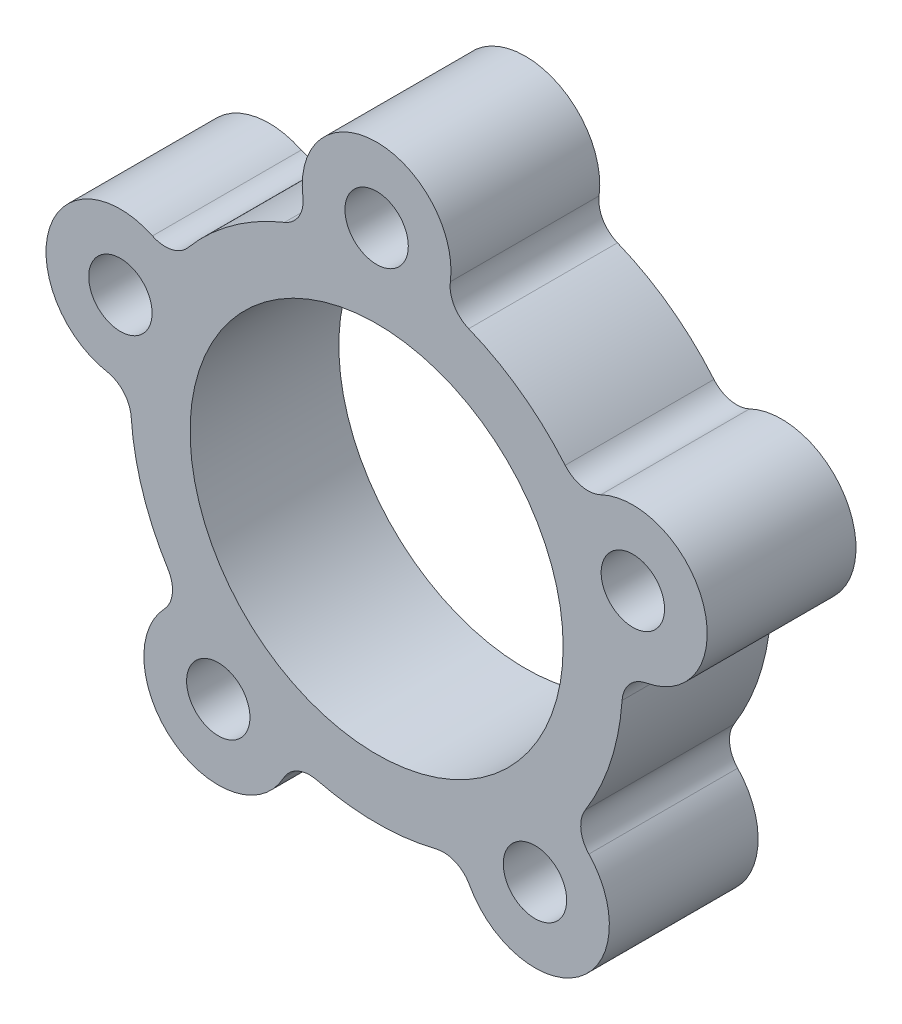
from build123d import *

# Parameters (mm, degrees)
SKETCH1_R             = 7.9629
BOSS_EXTRUDE1_DEPTH   = 6.35
F_6_32_TAPPED_HOLE1_D = 2.7051


with BuildPart() as part:
    # Sketch1 → Boss-Extrude1 (new body)
    with BuildSketch(Plane.XY.offset(11.1125)):
        with BuildLine():
            ThreePointArc((8.047909304, 6.74848607), (6.173449726, 8.49702459), (3.931250908, 9.739413469))
            ThreePointArc((3.931250908, 9.739413469), (3.309450684, 10.277458281), (3.147581267, 11.08363818))
            ThreePointArc((3.147581267, 11.08363818), (0, 14.675), (-3.147581267, 11.08363818))
            ThreePointArc((-3.147581267, 11.08363818), (-3.309450684, 10.277458281), (-3.931250908, 9.739413469))
            ThreePointArc((-3.931250908, 9.739413469), (-6.173449726, 8.49702459), (-8.047909304, 6.74848607))
            ThreePointArc((-8.047909304, 6.74848607), (-8.751767166, 6.323383906), (-9.568510213, 6.418560232))
            ThreePointArc((-9.568510213, 6.418560232), (-13.956754377, 4.534824392), (-11.513822419, 0.431504882))
            ThreePointArc((-11.513822419, 0.431504882), (-10.797120172, 0.028434629), (-10.477555984, -0.729197516))
            ThreePointArc((-10.477555984, -0.729197516), (-9.988851485, -3.24557459), (-8.905132396, -5.568619705))
            ThreePointArc((-8.905132396, -5.568619705), (-8.718340254, -6.369392103), (-9.061245801, -7.116749798))
            ThreePointArc((-9.061245801, -7.116749798), (-8.625748577, -11.872324392), (-3.968352328, -10.816953497))
            ThreePointArc((-3.968352328, -10.816953497), (-3.363536563, -10.259884713), (-2.544234809, -10.190082318))
            ThreePointArc((-2.544234809, -10.190082318), (0, -10.5029), (2.544234809, -10.190082318))
            ThreePointArc((2.544234809, -10.190082318), (3.363536563, -10.259884713), (3.968352328, -10.816953497))
            ThreePointArc((3.968352328, -10.816953497), (8.625748577, -11.872324392), (9.061245801, -7.116749798))
            ThreePointArc((9.061245801, -7.116749798), (8.718340254, -6.369392103), (8.905132396, -5.568619705))
            ThreePointArc((8.905132396, -5.568619705), (9.988851485, -3.24557459), (10.477555984, -0.729197516))
            ThreePointArc((10.477555984, -0.729197516), (10.797120172, 0.028434629), (11.513822419, 0.431504882))
            ThreePointArc((11.513822419, 0.431504882), (13.956754377, 4.534824392), (9.568510213, 6.418560232))
            ThreePointArc((9.568510213, 6.418560232), (8.751767166, 6.323383906), (8.047909304, 6.74848607))
        make_face()
        Circle(SKETCH1_R, mode=Mode.SUBTRACT)
    extrude(amount=BOSS_EXTRUDE1_DEPTH)

    # #6-32 Tapped Hole1 (through all)
    with Locations(Plane.XY.offset(17.4625)):
        with Locations((-10.937149937, 3.553695435), (0, 11.5), (10.937149937, 3.553695435), (6.759530401, -9.303695435), (-6.759530401, -9.303695435)):
            Hole(F_6_32_TAPPED_HOLE1_D / 2)


solid = part.part
